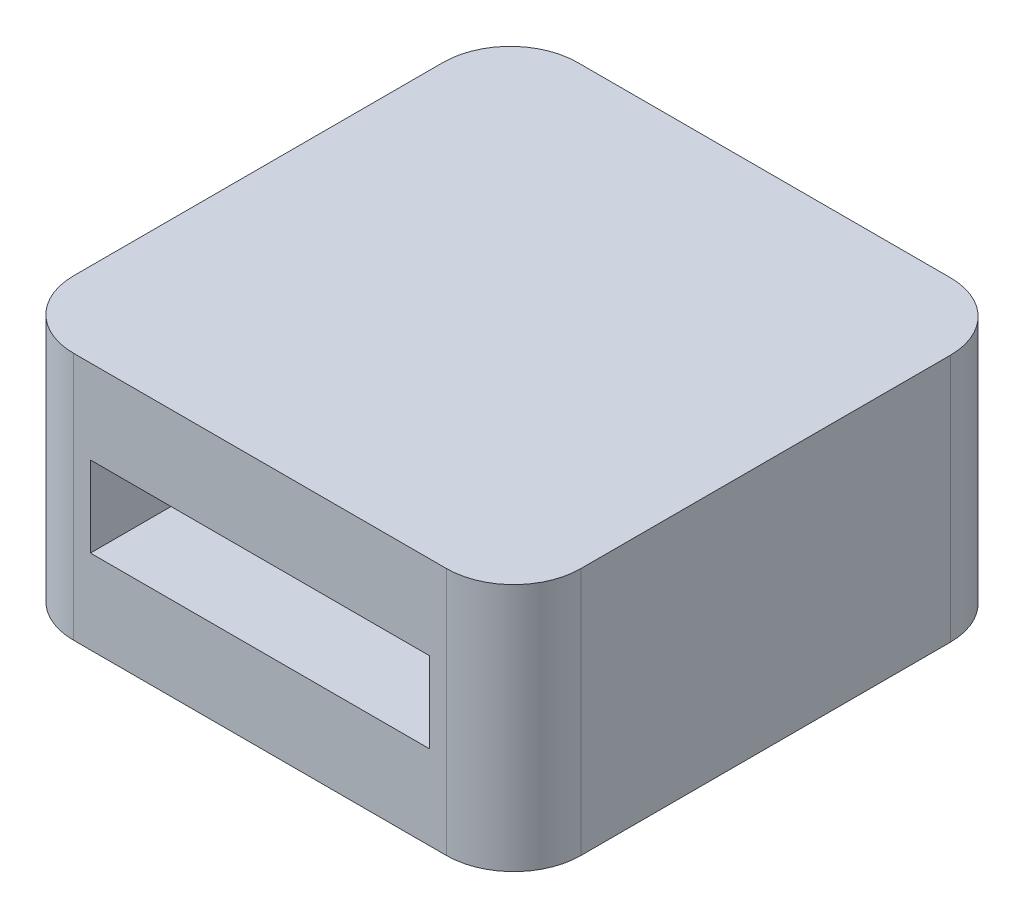
from build123d import *

# Parameters (mm, degrees)
PROFILE_SKETCH_W      = 15.1
PROFILE_SKETCH_H      = 7.4
PROFILE_SKETCH_W_2    = 10.1
PROFILE_SKETCH_H_2    = 2.4
PROFILE_EXTRUDE_DEPTH = 15
CORNER_FILLETS_R      = 2


with BuildPart() as part:
    # Profile Sketch → Profile Extrude (new body)
    with BuildSketch(Plane.XY):
        Rectangle(PROFILE_SKETCH_W, PROFILE_SKETCH_H)
        Rectangle(PROFILE_SKETCH_W_2, PROFILE_SKETCH_H_2, mode=Mode.SUBTRACT)
    extrude(amount=PROFILE_EXTRUDE_DEPTH)

    # Corner Fillets
    corner_fillets_edges = [part.edges().sort_by_distance(p)[0] for p in [
        (-7.55, 0, 0),
        (7.55, 0, 0),
        (7.55, 0, 15),
        (-7.55, 0, 15),
    ]]
    fillet(corner_fillets_edges, radius=CORNER_FILLETS_R)


solid = part.part
